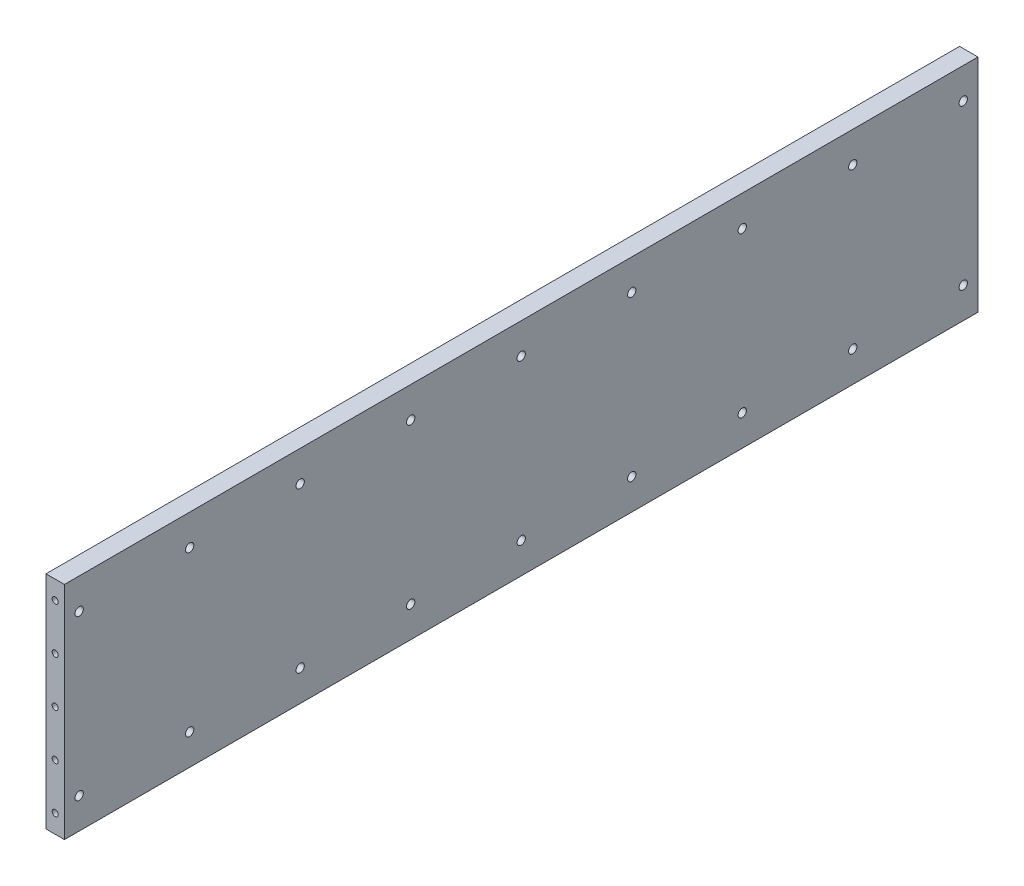
from build123d import *

# Parameters (mm, degrees)
SKETCH2_W                  = 10
SKETCH2_H                  = 120
BOSS_EXTRUDE1_DEPTH        = 496
M4_TAPPED_HOLE1_D          = 3.3
M4_TAPPED_HOLE1_DEPTH      = 14.1
M4_TAPPED_HOLE1_TIP        = 0.991420021
M4_TAPPED_HOLE2_D          = 3.3
M4_TAPPED_HOLE2_DEPTH      = 14.1
M4_TAPPED_HOLE2_TIP        = 0.991420021
F_4_5_4_5_DIAMETER_HOLE1_D = 4.5


with BuildPart() as part:
    # Sketch2 → Boss-Extrude1 (new body)
    with BuildSketch(Plane.XY):
        with Locations((-5, -60)):
            Rectangle(SKETCH2_W, SKETCH2_H)
    extrude(amount=BOSS_EXTRUDE1_DEPTH)

    # M4 Tapped Hole1
    with Locations(Plane(origin=(-5, -10, 496), x_dir=(1, 0, 0), z_dir=(0, 0, 1))):
        with Locations((0, 0), (0, -25), (0, -50), (0, -75), (0, -100)):
            Hole(M4_TAPPED_HOLE1_D / 2, depth=M4_TAPPED_HOLE1_DEPTH)
            with Locations((0, 0, -(M4_TAPPED_HOLE1_DEPTH + M4_TAPPED_HOLE1_TIP / 2))):  # 118° drill point
                Cone(0, M4_TAPPED_HOLE1_D / 2, M4_TAPPED_HOLE1_TIP, mode=Mode.SUBTRACT)

    # M4 Tapped Hole2
    with Locations(Plane(origin=(-5, -10, 0), x_dir=(-1, 0, 0), z_dir=(0, 0, -1))):
        with Locations((0, 0), (0, -25), (0, -50), (0, -75), (0, -100)):
            Hole(M4_TAPPED_HOLE2_D / 2, depth=M4_TAPPED_HOLE2_DEPTH)
            with Locations((0, 0, -(M4_TAPPED_HOLE2_DEPTH + M4_TAPPED_HOLE2_TIP / 2))):  # 118° drill point
                Cone(0, M4_TAPPED_HOLE2_D / 2, M4_TAPPED_HOLE2_TIP, mode=Mode.SUBTRACT)

    # Ø4.5 (4.5) Diameter Hole1 (through all)
    with Locations(Plane(origin=(0, -16.7, 488), x_dir=(0, 0, 1), z_dir=(1, 0, 0))):
        with Locations((0, 0), (-60, 0), (-120, 0), (-180, 0), (-240, 0), (-300, 0), (-360, 0), (-420, 0), (-480, 0), (-480, 86.6), (-420, 86.6), (-360, 86.6), (-300, 86.6), (-240, 86.6), (-180, 86.6), (-120, 86.6), (-60, 86.6), (0, 86.6)):
            Hole(F_4_5_4_5_DIAMETER_HOLE1_D / 2)


solid = part.part
